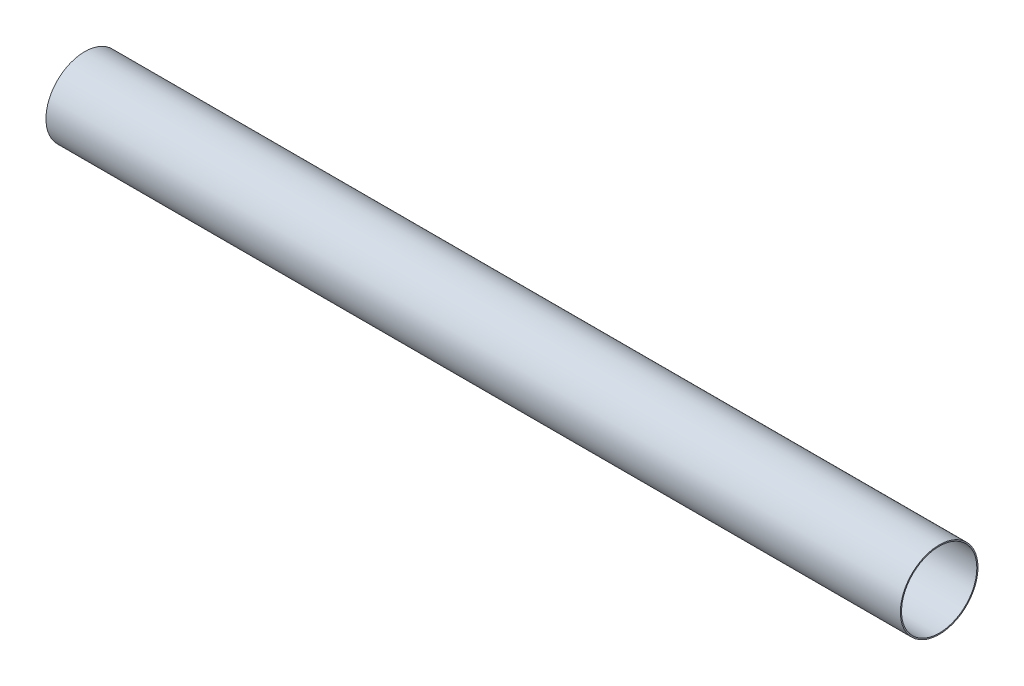
from build123d import *

# Parameters (mm, degrees)
SKETCH1_R           = 26.19375
SKETCH1_R_2         = 25.4
BOSS_EXTRUDE1_DEPTH = 288.29


with BuildPart() as part:
    # Sketch1 → Boss-Extrude1 (new, symmetric)
    with BuildSketch(Plane(origin=(0, 0, 0), x_dir=(0, 0, -1), z_dir=(1, 0, 0))):
        Circle(SKETCH1_R)
        Circle(SKETCH1_R_2, mode=Mode.SUBTRACT)
    extrude(amount=BOSS_EXTRUDE1_DEPTH, both=True)


solid = part.part
